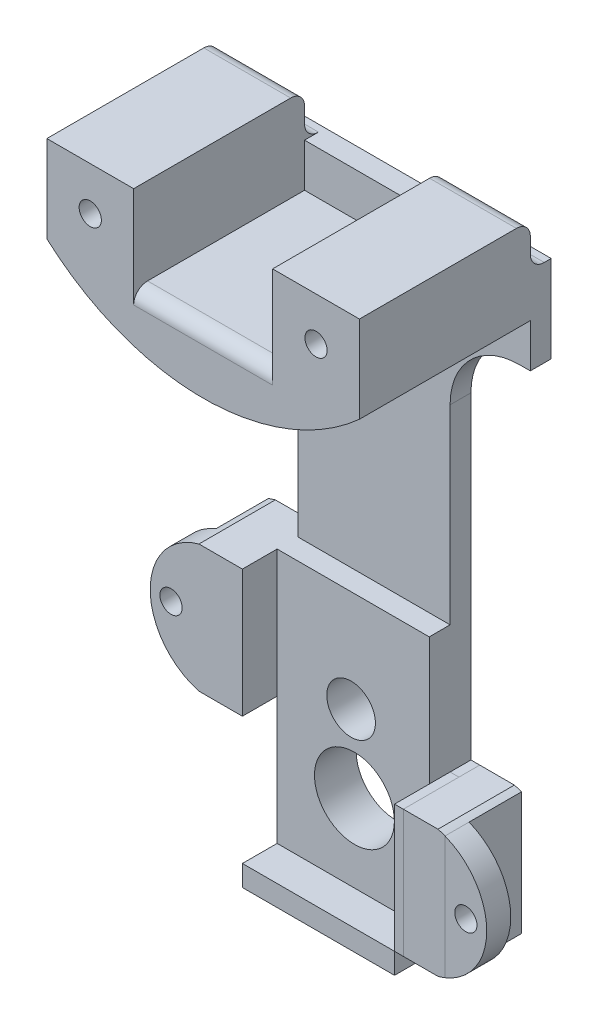
from build123d import *

# Parameters (mm, degrees)
BOSS_EXTRUDE1_DEPTH     = 24.6
BOSS_EXTRUDE2_DEPTH     = 3
SKETCH5_W               = 21.9
SKETCH5_H               = 3
BOSS_EXTRUDE3_DEPTH     = 37
CUT_EXTRUDE1_REACH      = 1273.984
SKETCH7_R               = 5.75
SKETCH8_W               = 3
SKETCH8_H               = 36.7
BOSS_EXTRUDE4_DEPTH     = 1.27
SKETCH9_W               = 3
SKETCH9_H               = 18.35
BOSS_EXTRUDE5_DEPTH     = 6
SKETCH11_W              = 6
SKETCH11_H              = 18.35
BOSS_EXTRUDE6_DEPTH     = 8
SKETCH12_W              = 6
SKETCH12_H              = 18.35
BOSS_EXTRUDE7_DEPTH     = 6
SKETCH14_R              = 1.6
CUT_EXTRUDE2_DEPTH      = 1272.885826469
CUT_EXTRUDE3_DEPTH      = 1272.984495021
SKETCH17_R              = 1.6
CUT_EXTRUDE4_DEPTH      = 1272.984495021
FILLET5_R               = 2
SKETCH18_R              = 3.1
CUT_EXTRUDE5_DEPTH      = 15
FILLET8_R               = 2
SKETCH19_W              = 3
SKETCH19_H              = 18.35
BOSS_EXTRUDE9_DEPTH     = 1.27
SKETCH20_W              = 6
SKETCH20_H              = 18.35
BOSS_EXTRUDE10_DEPTH    = 11
SKETCH21_W              = 6
SKETCH21_H              = 18.35
BOSS_EXTRUDE12_DEPTH    = 6
SKETCH22_R              = 1.6
CUT_EXTRUDE6_DEPTH      = 1274.45651229
CUT_EXTRUDE7_DEPTH      = 1274.45651229
CUT_EXTRUDE7_DEPTH_BACK = 1274.45651229
SKETCH24_R              = 3.5
CUT_EXTRUDE9_DEPTH      = 3
SKETCH25_W              = 21.9
SKETCH25_H              = 36.7
SKETCH25_R              = 5.75
SKETCH25_R_2            = 3.5
BOSS_EXTRUDE13_DEPTH    = 3
SKETCH26_W              = 21.9
SKETCH26_H              = 8
BOSS_EXTRUDE14_DEPTH    = 3
SKETCH27_W              = 8
SKETCH27_H              = 18.35
BOSS_EXTRUDE15_DEPTH    = 1.27
SKETCH28_W              = 8
SKETCH28_H              = 18.35
BOSS_EXTRUDE17_DEPTH    = 1.27
SKETCH31_W              = 2.54
SKETCH31_H              = 17.673744651
CUT_EXTRUDE16_DEPTH     = 1235.317826103
SKETCH32_W              = 7.54
SKETCH32_H              = 18.35
CUT_EXTRUDE17_DEPTH     = 1235.317826103


with BuildPart() as part:
    # Sketch1 → Boss-Extrude1 (new body)
    with BuildSketch(Plane(origin=(0, 0, 1119.483697074), x_dir=(-1, 0, 0), z_dir=(0, 0, -1))):
        with BuildLine():
            Line((-1161.329927858, 505.6656047), (-1161.329927858, 518.1656047))
            Line((-1161.329927858, 518.1656047), (-1148.829927858, 518.1656047))
            Line((-1148.829927858, 518.1656047), (-1148.829927858, 505.6656047))
            add(Edge.make_bspline(
                [(-1148.829927858, 505.6656047), (-1142.163261192, 505.6656047), (-1135.496594525, 505.6656047), (-1128.829927858, 505.6656047)],
                knots=[0.277777778, 0.277777778, 0.277777778, 0.277777778, 0.722222222, 0.722222222, 0.722222222, 0.722222222], degree=3))
            Line((-1128.829927858, 505.6656047), (-1128.829927858, 518.1656047))
            Line((-1128.829927858, 518.1656047), (-1116.329927858, 518.1656047))
            Line((-1116.329927858, 518.1656047), (-1116.329927858, 505.6656047))
            ThreePointArc((-1116.329927858, 505.6656047), (-1138.829927858, 497.038297899), (-1161.329927858, 505.6656047))
        make_face()
    extrude(amount=BOSS_EXTRUDE1_DEPTH)

    # Sketch4 → Boss-Extrude2 (add)
    with BuildSketch(Plane(origin=(0, 0, 1094.883697074), x_dir=(-1, 0, 0), z_dir=(0, 0, -1))):
        with BuildLine():
            Line((-1149.779927858, 462.266600027), (-1149.779927858, 489.392833753))
            ThreePointArc((-1149.779927858, 489.392833753), (-1152.708860047, 496.463901565), (-1159.779927858, 499.392833753))
            Line((-1159.779927858, 499.392833753), (-1161.329927858, 499.392833753))
            Line((-1161.329927858, 499.392833753), (-1161.329927858, 511.9156047))
            Line((-1161.329927858, 511.9156047), (-1116.329927858, 511.9156047))
            Line((-1116.329927858, 511.9156047), (-1116.329927858, 499.392833753))
            Line((-1116.329927858, 499.392833753), (-1117.879927858, 499.392833753))
            ThreePointArc((-1117.879927858, 499.392833753), (-1124.95099567, 496.463901565), (-1127.879927858, 489.392833753))
            Line((-1127.879927858, 489.392833753), (-1127.879927858, 462.266600027))
            Line((-1127.879927858, 462.266600027), (-1149.779927858, 462.266600027))
        make_face()
    extrude(amount=BOSS_EXTRUDE2_DEPTH)

    # Sketch5 → Boss-Extrude3 (add)
    with BuildSketch(Plane.XZ.offset(-462.266600027)):
        with Locations((1138.829927858, 1093.383697074)):
            Rectangle(SKETCH5_W, SKETCH5_H)
    extrude(amount=BOSS_EXTRUDE3_DEPTH)

    # Sketch7 → Cut-Extrude1 (cut, up to next)
    with BuildSketch(Plane(origin=(0, 0, 1091.883697074), x_dir=(-1, 0, 0), z_dir=(0, 0, -1)), mode=Mode.PRIVATE) as cut_extrude1_sk1:
        with Locations(Location((-1139.009861583, 436.459083358, 0), (0, 0, 90))):
            Circle(SKETCH7_R)
    cut_extrude1_tool1 = extrude(cut_extrude1_sk1.sketch, amount=-CUT_EXTRUDE1_REACH, mode=Mode.PRIVATE) & part.part
    add(cut_extrude1_tool1.solids().sort_by_distance((1139.009862, 436.459083, 1091.883697))[0], mode=Mode.SUBTRACT)



with BuildPart() as body_2:
    # Sketch8 → Boss-Extrude4 (new body)
    with BuildSketch(Plane.ZY.offset(-1127.879927858)):
        with Locations((1093.383697074, 443.616600027)):
            Rectangle(SKETCH8_W, SKETCH8_H)
    extrude(amount=BOSS_EXTRUDE4_DEPTH)


with BuildPart() as part_1:
    add(part.part)

    add(body_2.part)  # Boss-Extrude5 merges body 2
    # Sketch9 → Boss-Extrude5 (add)
    with BuildSketch(Plane.ZY.offset(-1126.609927858)):
        with Locations((1093.383697074, 452.791600027)):
            Rectangle(SKETCH9_W, SKETCH9_H)
    extrude(amount=BOSS_EXTRUDE5_DEPTH)

    # Sketch11 → Boss-Extrude6 (add)
    with BuildSketch(Plane.XY.offset(1094.883697074)):
        with Locations((1123.609927858, 452.791600027)):
            Rectangle(SKETCH11_W, SKETCH11_H)
    extrude(amount=BOSS_EXTRUDE6_DEPTH)

    # Sketch12 → Boss-Extrude7 (add)
    with BuildSketch(Plane.ZY.offset(-1120.609927858)):
        with Locations((1099.883697074, 452.791600027)):
            Rectangle(SKETCH12_W, SKETCH12_H)
    extrude(amount=BOSS_EXTRUDE7_DEPTH)

    # Sketch14 → Cut-Extrude2 (cut, through all)
    with BuildSketch(Plane(origin=(0, 0, 1096.883697074), x_dir=(-1, 0, 0), z_dir=(0, 0, -1))):
        with Locations((-1117.609927858, 452.791600027)):
            Circle(SKETCH14_R)
    extrude(amount=-CUT_EXTRUDE2_DEPTH, mode=Mode.SUBTRACT)

    # Sketch16 → Cut-Extrude3 (cut, through all)
    with BuildSketch(Plane(origin=(0, 0, 1091.883697074), x_dir=(-1, 0, 0), z_dir=(0, 0, -1))):
        with BuildLine():
            Line((-1126.609927858, 461.966600027), (-1126.609927858, 463.878724732))
            Line((-1126.609927858, 463.878724732), (-1111.609927858, 463.878724732))
            Line((-1111.609927858, 463.878724732), (-1111.609927858, 441.878724732))
            Line((-1111.609927858, 441.878724732), (-1126.609927858, 441.878724732))
            Line((-1126.609927858, 441.878724732), (-1126.609927858, 443.616600027))
            ThreePointArc((-1126.609927858, 443.616600027), (-1114.609927858, 452.791600027), (-1126.609927858, 461.966600027))
        make_face()
    extrude(amount=-CUT_EXTRUDE3_DEPTH, mode=Mode.SUBTRACT)

    # Sketch17 → Cut-Extrude4 (cut, through all)
    with BuildSketch(Plane(origin=(0, 0, 1091.883697074), x_dir=(-1, 0, 0), z_dir=(0, 0, -1))):
        with Locations(Location((-1122.579927858, 511.9156047, 0), (0, 0, 90))):
            Circle(SKETCH17_R)
        with Locations(Location((-1155.079927858, 511.9156047, 0), (0, 0, 90))):
            Circle(SKETCH17_R)
    extrude(amount=-CUT_EXTRUDE4_DEPTH, mode=Mode.SUBTRACT)

    # Fillet5
    # the kernel refuses this fillet: 2 mm, written as the material it adds along each edge
    with BuildSketch(Plane(origin=(1128.829927858, 511.9156047, 1094.883697074), x_dir=(0, 0, -1), z_dir=(-1, 0, 0))) as fillet5_piece_1_section:
        with BuildLine():
            CenterArc((FILLET5_R, -FILLET5_R), FILLET5_R, 90, 90)
            Line((0, -FILLET5_R), (0, 0))
            Line((0, 0), (FILLET5_R, 0))
        make_face()
    fillet5_piece_1 = extrude(amount=9.65, mode=Mode.PRIVATE)
    fillet5_piece_1 = fillet5_piece_1 - Plane(origin=(1122.579927858, 511.9156047, 1094.447824363), x_dir=(0, 1, 0), z_dir=(0, 0, -1)) * Cylinder(1.6, 28, mode=Mode.PRIVATE)
    add(fillet5_piece_1)
    with BuildSketch(Plane(origin=(1161.329927858, 511.9156047, 1094.883697074), x_dir=(0, 0, -1), z_dir=(-1, 0, 0))) as fillet5_piece_2_section:
        with BuildLine():
            CenterArc((FILLET5_R, -FILLET5_R), FILLET5_R, 90, 90)
            Line((0, -FILLET5_R), (0, 0))
            Line((0, 0), (FILLET5_R, 0))
        make_face()
    fillet5_piece_2 = extrude(amount=9.65, mode=Mode.PRIVATE)
    fillet5_piece_2 = fillet5_piece_2 - Plane(origin=(1155.079927858, 511.9156047, 1094.447824363), x_dir=(0, 1, 0), z_dir=(0, 0, -1)) * Cylinder(1.6, 28, mode=Mode.PRIVATE)
    add(fillet5_piece_2)
    with BuildSketch(Plane(origin=(1158.479927859, 511.9156047, 1094.883697074), x_dir=(0, 0, -1), z_dir=(-1, 0, 0))) as fillet5_piece_3_section:
        with BuildLine():
            CenterArc((FILLET5_R, -FILLET5_R), FILLET5_R, 90, 90)
            Line((0, -FILLET5_R), (0, 0))
            Line((0, 0), (FILLET5_R, 0))
        make_face()
    fillet5_piece_3 = extrude(amount=9.65, mode=Mode.PRIVATE)
    fillet5_piece_3 = fillet5_piece_3 - Plane(origin=(1155.079927858, 511.9156047, 1094.447824598), x_dir=(0, 1, 0), z_dir=(0, 0, -1)) * Cylinder(1.6, 28, mode=Mode.PRIVATE)
    add(fillet5_piece_3)
    with BuildSketch(Plane(origin=(1125.979927859, 511.9156047, 1094.883697074), x_dir=(0, 0, -1), z_dir=(-1, 0, 0))) as fillet5_piece_4_section:
        with BuildLine():
            CenterArc((FILLET5_R, -FILLET5_R), FILLET5_R, 90, 90)
            Line((0, -FILLET5_R), (0, 0))
            Line((0, 0), (FILLET5_R, 0))
        make_face()
    fillet5_piece_4 = extrude(amount=9.65, mode=Mode.PRIVATE)
    fillet5_piece_4 = fillet5_piece_4 - Plane(origin=(1122.579927858, 511.9156047, 1094.447824598), x_dir=(0, 1, 0), z_dir=(0, 0, -1)) * Cylinder(1.6, 28, mode=Mode.PRIVATE)
    add(fillet5_piece_4)
    # the kernel refuses this fillet: 2 mm, written as the material it takes off along each edge
    with BuildSketch(Plane(origin=(1133.829927858, 518.1656047, 1094.883697074), x_dir=(0, -1, 0), z_dir=(-1, 0, 0))) as fillet5_2_piece_1:
        with BuildLine():
            CenterArc((FILLET5_R, FILLET5_R), FILLET5_R, 180, 90)
            Line((0, FILLET5_R), (0, 0))
            Line((0, 0), (FILLET5_R, 0))
        make_face()
    extrude(amount=22.5, mode=Mode.SUBTRACT)
    with BuildSketch(Plane(origin=(1166.329927858, 518.1656047, 1094.883697074), x_dir=(0, 0, 1), z_dir=(-1, 0, 0))) as fillet5_2_piece_2:
        with BuildLine():
            CenterArc((FILLET5_R, -FILLET5_R), FILLET5_R, 90, 90)
            Line((0, -FILLET5_R), (0, 0))
            Line((0, 0), (FILLET5_R, 0))
        make_face()
    extrude(amount=22.5, mode=Mode.SUBTRACT)

    # Sketch18 → Cut-Extrude5 (cut)
    with BuildSketch(Plane(origin=(0, 0, 1091.883697074), x_dir=(-1, 0, 0), z_dir=(0, 0, -1))):
        with Locations(Location((-1155.079927858, 511.9156047, 0), (0, 0, 90))):
            Circle(SKETCH18_R)
        with Locations(Location((-1122.579927858, 511.9156047, 0), (0, 0, 90))):
            Circle(SKETCH18_R)
    extrude(amount=-CUT_EXTRUDE5_DEPTH, mode=Mode.SUBTRACT)

    # Fillet8
    fillet8_edges = [part_1.edges().sort_by_distance(p)[0] for p in [
        (1138.829927858, 505.6656047, 1119.483697074),
    ]]
    fillet(fillet8_edges, radius=FILLET8_R)

    # Sketch24 → Cut-Extrude9 (cut)
    with BuildSketch(Plane(origin=(0, 0, 1091.883697074), x_dir=(-1, 0, 0), z_dir=(0, 0, -1))):
        with Locations(Location((-1138.529927858, 447.326151989, 0), (0, 0, 90))):
            Circle(SKETCH24_R)
    extrude(amount=-CUT_EXTRUDE9_DEPTH, mode=Mode.SUBTRACT)



with BuildPart() as body_2_2:
    # Sketch19 → Boss-Extrude9 (new body)
    with BuildSketch(Plane(origin=(1149.779927858, 0, 0), x_dir=(0, 0, -1), z_dir=(1, 0, 0))):
        with Locations((-1093.383697074, 434.441600027)):
            Rectangle(SKETCH19_W, SKETCH19_H)
    extrude(amount=BOSS_EXTRUDE9_DEPTH)


with BuildPart() as body_3:
    # Sketch20 → Boss-Extrude10 (new body)
    with BuildSketch(Plane(origin=(0, 0, 1091.883697074), x_dir=(-1, 0, 0), z_dir=(0, 0, -1))):
        with Locations((-1154.049927858, 434.441600027)):
            Rectangle(SKETCH20_W, SKETCH20_H)
    extrude(amount=-BOSS_EXTRUDE10_DEPTH)


with BuildPart() as body_4:
    # Sketch21 → Boss-Extrude12 (new body)
    with BuildSketch(Plane(origin=(1157.049927858, 0, 0), x_dir=(0, 0, -1), z_dir=(1, 0, 0))):
        with Locations((-1099.883697074, 434.441600027)):
            Rectangle(SKETCH21_W, SKETCH21_H)
    extrude(amount=BOSS_EXTRUDE12_DEPTH)

    # Sketch22 → Cut-Extrude6 (cut, through all)
    with BuildSketch(Plane(origin=(0, 0, 1096.883697074), x_dir=(-1, 0, 0), z_dir=(0, 0, -1))):
        with Locations((-1160.049927858, 434.441600027)):
            Circle(SKETCH22_R)
    extrude(amount=-CUT_EXTRUDE6_DEPTH, mode=Mode.SUBTRACT)


with BuildPart() as cut_extrude7_tool:
    # Sketch23 → Cut-Extrude7 (new, two sides: drawn at the far end of the back side and taken through both)
    with BuildSketch(Plane(origin=(0, 0, 1096.883697074), x_dir=(-1, 0, 0), z_dir=(0, 0, -1)).offset(-CUT_EXTRUDE7_DEPTH_BACK)):
        with BuildLine():
            Line((-1151.049927858, 425.266600027), (-1151.049927858, 419.441600027))
            Line((-1151.049927858, 419.441600027), (-1166.049927858, 419.441600027))
            Line((-1166.049927858, 419.441600027), (-1166.049927858, 449.441600027))
            Line((-1166.049927858, 449.441600027), (-1151.049927858, 449.441600027))
            Line((-1151.049927858, 449.441600027), (-1151.049927858, 443.616600027))
            ThreePointArc((-1151.049927858, 443.616600027), (-1163.049927858, 434.441600027), (-1151.049927858, 425.266600027))
        make_face()
    extrude(amount=CUT_EXTRUDE7_DEPTH + CUT_EXTRUDE7_DEPTH_BACK)


with BuildPart() as body_3_1:
    add(body_3.part)

    # Cut-Extrude7: cut by cut_extrude7_tool
    add(cut_extrude7_tool.part, mode=Mode.SUBTRACT)


with BuildPart() as body_4_1:
    add(body_4.part)

    # Cut-Extrude7: cut by cut_extrude7_tool
    add(cut_extrude7_tool.part, mode=Mode.SUBTRACT)

    # Sketch31 → Cut-Extrude16 (cut, through all)
    with BuildSketch(Plane(origin=(1157.049927858, 0, 0), x_dir=(0, 0, -1), z_dir=(1, 0, 0))):
        with Locations((-1098.153697074, 434.441600027)):
            Rectangle(SKETCH31_W, SKETCH31_H)
    extrude(amount=CUT_EXTRUDE16_DEPTH, mode=Mode.SUBTRACT)


with BuildPart() as body_5:
    # Sketch25 → Boss-Extrude13 (new body)
    with BuildSketch(Plane.XY.offset(1094.883697074)):
        with Locations((1138.829927858, 443.616600027)):
            Rectangle(SKETCH25_W, SKETCH25_H)
        with Locations(Location((1139.009861583, 436.459083358, 0), (0, 0, 90))):
            Circle(SKETCH25_R, mode=Mode.SUBTRACT)
        with Locations(Location((1138.529927858, 447.326151989, 0), (0, 0, 90))):
            Circle(SKETCH25_R_2, mode=Mode.SUBTRACT)
    extrude(amount=BOSS_EXTRUDE13_DEPTH)


with BuildPart() as part_2:
    add(part_1.part)

    add(body_5.part)  # Boss-Extrude14 merges body 5
    # Sketch26 → Boss-Extrude14 (add)
    with BuildSketch(Plane.XZ.offset(-425.266600027)):
        with Locations((1138.829927858, 1098.883697074)):
            Rectangle(SKETCH26_W, SKETCH26_H)
    extrude(amount=BOSS_EXTRUDE14_DEPTH)

    # Sketch27 → Boss-Extrude15 (add)
    with BuildSketch(Plane(origin=(1126.609927858, 0, 0), x_dir=(0, 0, -1), z_dir=(1, 0, 0))):
        with Locations((-1098.883697074, 452.791600027)):
            Rectangle(SKETCH27_W, SKETCH27_H)
    extrude(amount=BOSS_EXTRUDE15_DEPTH)

    # Sketch32 → Cut-Extrude17 (cut, through all)
    with BuildSketch(Plane.ZY.offset(-1120.609927858)):
        with Locations((1095.653697074, 452.791600027)):
            Rectangle(SKETCH32_W, SKETCH32_H)
    extrude(amount=CUT_EXTRUDE17_DEPTH, mode=Mode.SUBTRACT)


with BuildPart() as body_5_2:
    # Sketch28 → Boss-Extrude17 (new body)
    with BuildSketch(Plane.ZY.offset(-1151.049927858)):
        with Locations((1098.883697074, 434.441600027)):
            Rectangle(SKETCH28_W, SKETCH28_H)
    extrude(amount=BOSS_EXTRUDE17_DEPTH)


solid = Compound([body_2_2.part, body_3_1.part, body_4_1.part, part_2.part, body_5_2.part])
